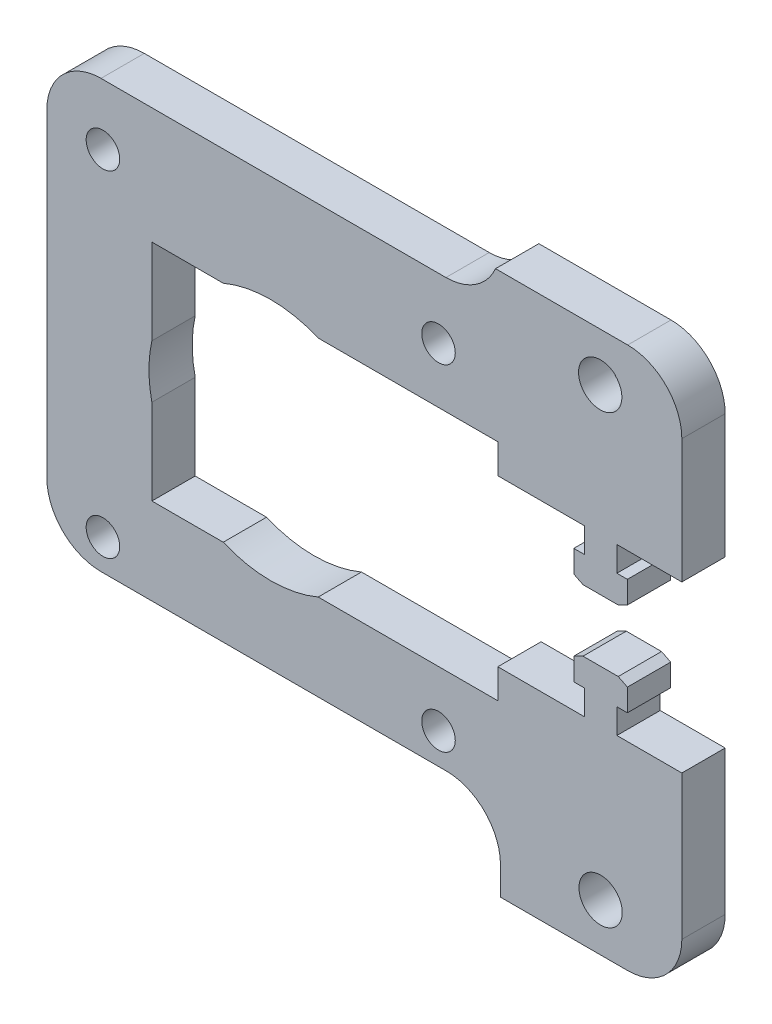
from build123d import *

# Parameters (mm, degrees)
SKETCH1_R           = 1.55
BOSS_EXTRUDE1_DEPTH = 4
SKETCH2_R           = 11.25
CUT_EXTRUDE1_DEPTH  = 10
SKETCH4_R           = 2
SKETCH4_W           = 16.7545444
SKETCH4_H           = 7.593360653
BOSS_EXTRUDE2_DEPTH = 4
SKETCH5_R           = 2.001806379
CUT_EXTRUDE2_DEPTH  = 79.038052705
FILLET1_R           = 5


with BuildPart() as part:
    # Sketch1 → Boss-Extrude1 (new body)
    with BuildSketch(Plane.XY):
        Polygon((-6.898627884, 24.176481231), (-6.898627884, 21.876481231), (-14.898627884, 21.876481231), (-14.898627884, 19.156481231), (-46.856968571, 19.156481231), (-46.856968571, 39.876481231), (-14.898627884, 39.876481231), (-14.898627884, 37.156481231), (-6.898627884, 37.156481231), (-6.898627884, 34.856481231), (-7.878627884, 34.856481231), (-7.878627884, 32.800088029), (-7.031414289, 32.376481231), (-3.77584148, 32.376481231), (-2.928627884, 32.800088029), (-2.928627884, 34.856481231), (-3.898627884, 34.856481231), (-3.898627884, 37.156481231), (2.101372116, 37.156481231), (2.101372116, 47.876481231), (2.101372116, 50.619437371), (-56.558762416, 50.619437371), (-56.558762416, 47.876481231), (-56.558762416, 39.876481231), (-56.558762416, 19.156481231), (-56.558762416, 11.156481231), (2.101372116, 11.156481231), (2.101372116, 21.876481231), (-3.898627884, 21.876481231), (-3.898627884, 24.176481231), (-2.928627884, 24.176481231), (-2.928627884, 26.232874433), (-3.77584148, 26.656481231), (-7.031414289, 26.656481231), (-7.878627884, 26.232874433), (-7.878627884, 24.176481231), align=None)
        with Locations((-51.378627884, 14.016481231)):
            Circle(SKETCH1_R, mode=Mode.SUBTRACT)
        with Locations((-20.378627884, 14.016481231)):
            Circle(SKETCH1_R, mode=Mode.SUBTRACT)
        with Locations((-51.378627884, 45.016481231)):
            Circle(SKETCH1_R, mode=Mode.SUBTRACT)
        with Locations((-20.378627884, 45.016481231)):
            Circle(SKETCH1_R, mode=Mode.SUBTRACT)
    extrude(amount=BOSS_EXTRUDE1_DEPTH)

    # Sketch2 → Cut-Extrude1 (cut)
    with BuildSketch(Plane.XY.offset(4)):
        with Locations((-35.878627884, 29.516481231)):
            Circle(SKETCH2_R)
    extrude(amount=-CUT_EXTRUDE1_DEPTH, mode=Mode.SUBTRACT)

    # Sketch4 → Boss-Extrude2 (add)
    # profile 1 of 2: a face of its own
    with BuildSketch(Plane(origin=(0, 0, 0), x_dir=(-1, 0, 0), z_dir=(0, 0, -1))):
        Polygon((-2.101372116, 50.619437371), (-2.101372116, 53.619437371), (15.109222475, 53.619437371), (15.109222475, 50.619437371), (15.109222475, 46.213030652), (-2.101372116, 46.03430596), align=None)
        with Locations((5.403627884, 49.175308869)):
            Circle(SKETCH4_R, mode=Mode.SUBTRACT)
    # profile 2 of 2: a face of its own
    with BuildSketch(Plane(origin=(0, 0, 0), x_dir=(-1, 0, 0), z_dir=(0, 0, -1))):
        with Locations((6.275900084, 7.359800905)):
            Rectangle(SKETCH4_W, SKETCH4_H)
        with Locations((5.403627884, 7.956481231)):
            Circle(SKETCH4_R, mode=Mode.SUBTRACT)
    extrude(amount=-BOSS_EXTRUDE2_DEPTH)

    # Sketch5 → Cut-Extrude2 (cut, through all)
    with BuildSketch(Plane(origin=(0, 0, 0), x_dir=(-1, 0, 0), z_dir=(0, 0, -1))):
        with Locations((5.440315917, 49.166162951)):
            Circle(SKETCH5_R)
    extrude(amount=-CUT_EXTRUDE2_DEPTH, mode=Mode.SUBTRACT)

    # Fillet1
    # the kernel refuses this fillet: 5 mm, written as the material it adds along each edge
    with BuildSketch(Plane(origin=(-14.653172284, 11.156481231, 0), x_dir=(0, -1, 0), z_dir=(0, 0, 1))) as fillet1_piece_1:
        with BuildLine():
            CenterArc((FILLET1_R, -FILLET1_R), FILLET1_R, 90, 90)
            Line((0, -FILLET1_R), (0, 0))
            Line((0, 0), (FILLET1_R, 0))
        make_face()
    extrude(amount=4)
    with BuildSketch(Plane(origin=(-15.109222475, 50.619437371, 0), x_dir=(-1, 0, 0), z_dir=(0, 0, 1))) as fillet1_piece_2:
        with BuildLine():
            CenterArc((4.582575695, -5), FILLET1_R, 90, 66.421821522)
            Line((0, -3), (0, 0))
            Line((0, 0), (4.582575695, 0))
        make_face()
    extrude(amount=4)
    # the kernel refuses this fillet: 5 mm, written as the material it takes off along each edge
    with BuildSketch(Plane(origin=(2.101372116, 53.619437371, -12.5), x_dir=(0, -1, 0), z_dir=(0, 0, 1)), Plane(origin=(2.101372116, 3.563120578, -12.5), x_dir=(-1, 0, 0), z_dir=(0, 0, 1)), Plane(origin=(-56.558762416, 11.156481231, -12.5), x_dir=(0, 1, 0), z_dir=(0, 0, 1)), Plane(origin=(-56.558762416, 50.619437371, -12.5), x_dir=(1, 0, 0), z_dir=(0, 0, 1))) as fillet1_2_piece_1:
        with BuildLine():
            CenterArc((FILLET1_R, -FILLET1_R), FILLET1_R, 90, 90)
            Line((0, -FILLET1_R), (0, 0))
            Line((0, 0), (FILLET1_R, 0))
        make_face()
    extrude(amount=29, mode=Mode.SUBTRACT)


solid = part.part
